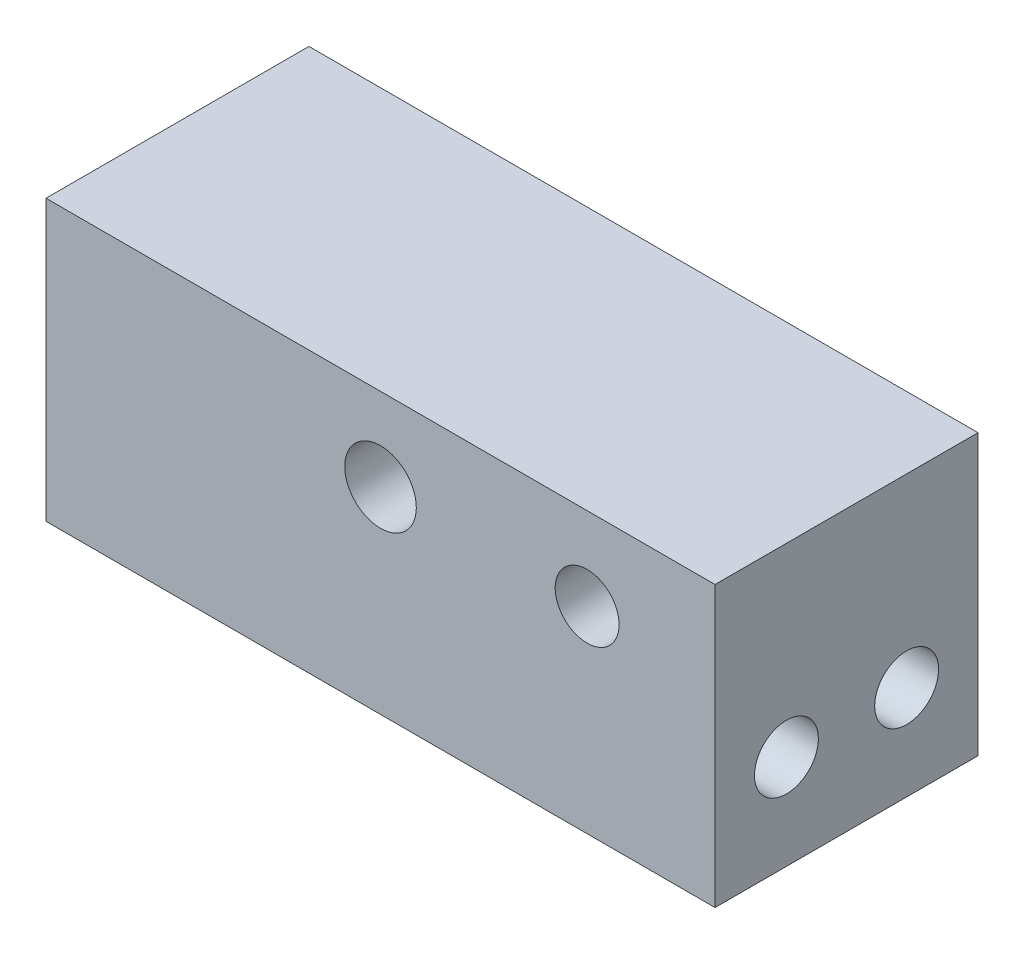
from build123d import *

# Parameters (mm, degrees)
SKETCH1_W           = 56.55
SKETCH1_H           = 22.225
BOSS_EXTRUDE1_DEPTH = 22.225
SKETCH2_R           = 2.7
SKETCH2_R_2         = 3.025
CUT_EXTRUDE1_DEPTH  = 10
SKETCH3_R           = 2.7
CUT_EXTRUDE2_DEPTH  = 8
SKETCH5_W           = 56.55
SKETCH5_H           = 22.225
BOSS_EXTRUDE2_DEPTH = 1.42494
SKETCH6_R           = 3.025
CUT_EXTRUDE3_DEPTH  = 10


with BuildPart() as part:
    # Sketch1 → Boss-Extrude1 (new body)
    with BuildSketch(Plane.XY):
        Rectangle(SKETCH1_W, SKETCH1_H)
    extrude(amount=BOSS_EXTRUDE1_DEPTH)

    # Sketch2 → Cut-Extrude1 (cut)
    with BuildSketch(Plane.XY.offset(22.225)):
        with Locations((17.4625, 4.1125)):
            Circle(SKETCH2_R)
        with Locations((0, 4.1125)):
            Circle(SKETCH2_R_2)
    extrude(amount=-CUT_EXTRUDE1_DEPTH, mode=Mode.SUBTRACT)

    # Sketch3 → Cut-Extrude2 (cut)
    with BuildSketch(Plane.ZY.offset(28.275)):
        with Locations((16.1925, -4.5375001)):
            Circle(SKETCH3_R)
        with Locations((6.0325, -4.5375001)):
            Circle(SKETCH3_R)
    cut_extrude2 = extrude(amount=-CUT_EXTRUDE2_DEPTH, mode=Mode.SUBTRACT)

    # Sketch5 → Boss-Extrude2 (add)
    with BuildSketch(Plane.XZ.offset(11.1125)):
        with Locations((0, 11.1125)):
            Rectangle(SKETCH5_W, SKETCH5_H)
    extrude(amount=BOSS_EXTRUDE2_DEPTH)

    # Mirror2: Cut-Extrude2 across plane
    add(cut_extrude2.mirror(Plane(origin=(0, 0, 0), x_dir=(0, 0, 1), z_dir=(1, 0, 0))), mode=Mode.SUBTRACT)

    # Sketch6 → Cut-Extrude3 (cut)
    with BuildSketch(Plane(origin=(0, 0, 0), x_dir=(-1, 0, 0), z_dir=(0, 0, -1))):
        with Locations((-10, 1.1125)):
            Circle(SKETCH6_R)
        with Locations((10, 1.1125)):
            Circle(SKETCH6_R)
    extrude(amount=-CUT_EXTRUDE3_DEPTH, mode=Mode.SUBTRACT)


solid = part.part
